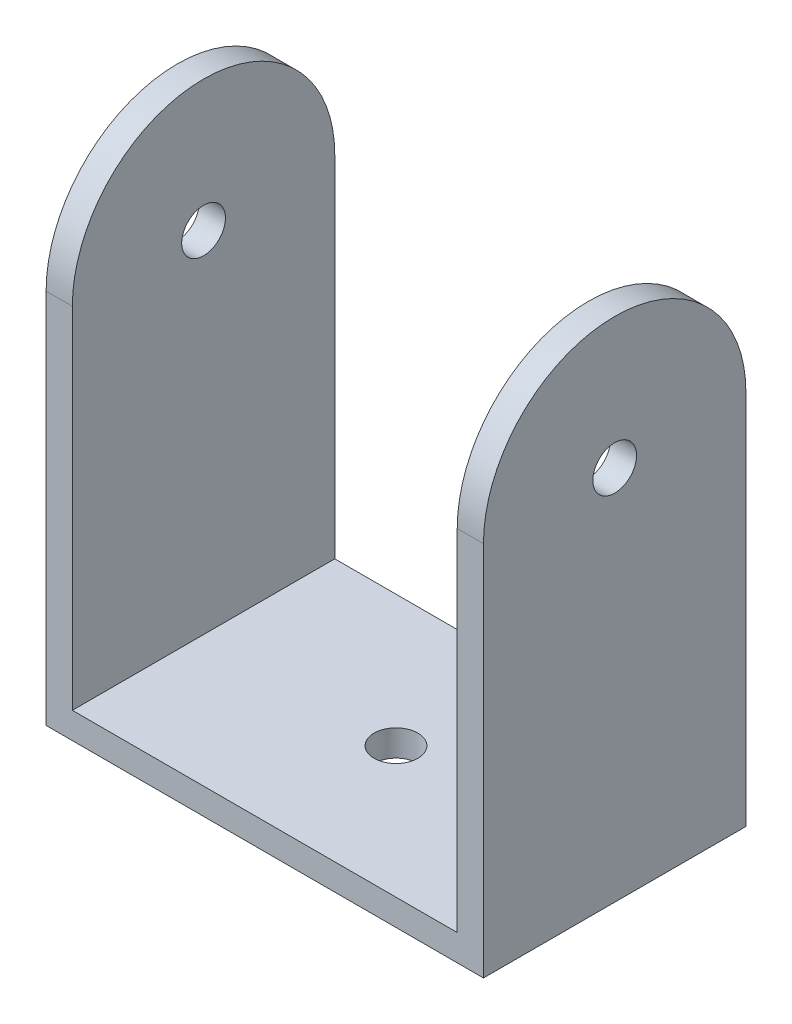
from build123d import *

# Parameters (mm, degrees)
SKETCH1_W           = 50
SKETCH1_H           = 30
BOSS_EXTRUDE1_DEPTH = 3
SKETCH2_R           = 2.5
BOSS_EXTRUDE2_DEPTH = 3
SKETCH3_R           = 2.5
CUT_EXTRUDE1_DEPTH  = 3


with BuildPart() as part:
    # Sketch1 → Boss-Extrude1 (new body)
    with BuildSketch(Plane(origin=(0, 0, 0), x_dir=(1, 0, 0), z_dir=(0, 1, 0))):
        Rectangle(SKETCH1_W, SKETCH1_H)
    extrude(amount=BOSS_EXTRUDE1_DEPTH)

    # Sketch2 → Boss-Extrude2 (add)
    with BuildSketch(Plane(origin=(25, 0, 0), x_dir=(0, 0, -1), z_dir=(1, 0, 0))):
        with BuildLine():
            Line((-15, 3), (-15, 43))
            ThreePointArc((-15, 43), (0, 58), (15, 43))
            Line((15, 43), (15, 3))
            Line((15, 3), (-15, 3))
        make_face()
        with Locations((0, 43)):
            Circle(SKETCH2_R, mode=Mode.SUBTRACT)
    boss_extrude2 = extrude(amount=-BOSS_EXTRUDE2_DEPTH)

    # Mirror1: Boss-Extrude2 across plane
    add(boss_extrude2.mirror(Plane(origin=(0, 0, 0), x_dir=(0, 0, 1), z_dir=(1, 0, 0))))

    # Sketch3 → Cut-Extrude1 (cut)
    with BuildSketch(Plane(origin=(0, 3, 0), x_dir=(1, 0, 0), z_dir=(0, 1, 0))):
        Circle(SKETCH3_R)
    extrude(amount=-CUT_EXTRUDE1_DEPTH, mode=Mode.SUBTRACT)


solid = part.part
